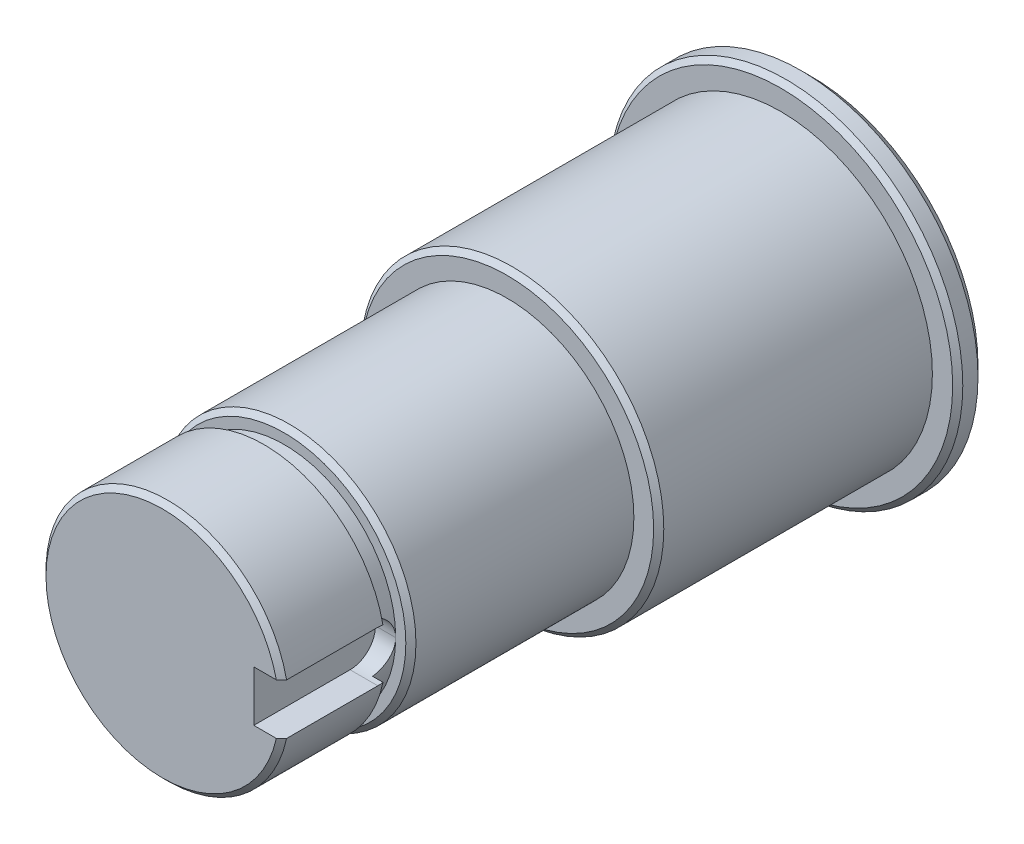
from build123d import *

# Parameters (mm, degrees)
SKETCH_1_R          = 17.45
EXTRUDE_1_DEPTH     = 3
SKETCH_2_R          = 14.95
EXTRUDE_2_DEPTH     = 27
SKETCH_4_R          = 12.5
EXTRUDE_3_DEPTH     = 22
SKETCH_5_R          = 12
EXTRUDE_4_DEPTH     = 12
CHAMFER_1_SIZE      = 0.5
SKETCH_6_W          = 1
SKETCH_6_H          = 2
CHAMFER_2_SIZE      = 0.5
CHAMFER_3_SIZE      = 1
SKETCH_7_W          = 12
SKETCH_7_H          = 5
CUT_EXTRUDE_1_DEPTH = 3
FILLET_1_R          = 2.5


with BuildPart() as part:
    # 草图1 → 拉伸1 (new body)
    with BuildSketch(Plane.XY):
        Circle(SKETCH_1_R)
    extrude(amount=EXTRUDE_1_DEPTH)

    # 草图2 → 拉伸2 (add)
    with BuildSketch(Plane.XY.offset(3)):
        Circle(SKETCH_2_R)
    extrude(amount=EXTRUDE_2_DEPTH)

    # 草图4 → 拉伸3 (add)
    with BuildSketch(Plane.XY.offset(30)):
        Circle(SKETCH_4_R)
    extrude(amount=EXTRUDE_3_DEPTH)

    # 草图5 → 拉伸4 (add)
    with BuildSketch(Plane.XY.offset(52)):
        Circle(SKETCH_5_R)
    extrude(amount=EXTRUDE_4_DEPTH)

    # 倒角1
    chamfer_1_edges = [part.edges().sort_by_distance(p)[0] for p in [
        (-12, 0, 64),
    ]]
    chamfer(chamfer_1_edges, length=CHAMFER_1_SIZE)

    # 草图6 → 切除-旋转1 (revolve, cut)
    with BuildSketch(Plane(origin=(0, 0, 0), x_dir=(1, 0, 0), z_dir=(0, 1, 0)), mode=Mode.PRIVATE) as cut_revolve_1_sk:
        with Locations((-11.5, -53)):
            Rectangle(SKETCH_6_W, SKETCH_6_H)
    revolve(cut_revolve_1_sk.sketch.rotate(Axis((0, 0, 52), (0, 0, -1)), 180), axis=Axis((0, 0, 52), (0, 0, -1)), mode=Mode.SUBTRACT)

    # 倒角2
    chamfer_2_edges = [part.edges().sort_by_distance(p)[0] for p in [
        (-12.5, 0, 52),
        (-17.45, 0, 3),
        (-14.95, 0, 30),
    ]]
    chamfer(chamfer_2_edges, length=CHAMFER_2_SIZE)

    # 倒角3
    chamfer_3_edges = [part.edges().sort_by_distance(p)[0] for p in [
        (-17.45, 0, 0),
    ]]
    chamfer(chamfer_3_edges, length=CHAMFER_3_SIZE)

    # 草图7 → 切除-拉伸1 (cut)
    with BuildSketch(Plane(origin=(12, 0, 0), x_dir=(0, 0, -1), z_dir=(1, 0, 0))):
        with Locations((-58, 0)):
            Rectangle(SKETCH_7_W, SKETCH_7_H)
    extrude(amount=-CUT_EXTRUDE_1_DEPTH, mode=Mode.SUBTRACT)

    # 圆角1
    # the kernel refuses this fillet: 2.5 mm, written as the material it adds along each edge
    with BuildSketch(Plane(origin=(16.962142643, -2.5, 52), x_dir=(0, 1, 0), z_dir=(-1, 0, 0))) as fillet_1_piece_1_section:
        with BuildLine():
            CenterArc((FILLET_1_R, -FILLET_1_R), FILLET_1_R, 90, 90)
            Line((0, -FILLET_1_R), (0, 0))
            Line((0, 0), (FILLET_1_R, 0))
        make_face()
    fillet_1_piece_1 = extrude(amount=14.212142643, mode=Mode.PRIVATE)
    fillet_1_piece_1 = fillet_1_piece_1 & Plane(origin=(0, 0, 54.124758418), x_dir=(1, 0, 0), z_dir=(0, 0, -1)) * Cylinder(12, 39, mode=Mode.PRIVATE)
    fillet_1_piece_1 = split(fillet_1_piece_1, bisect_by=Plane(origin=(11.227777132, -2.484876178, 54), z_dir=(0, 0, 1)), keep=Keep.TOP, mode=Mode.PRIVATE)
    add(fillet_1_piece_1)
    with BuildSketch(Plane(origin=(16.962142643, -2.5, 52), x_dir=(0, 1, 0), z_dir=(-1, 0, 0))) as fillet_1_piece_2_section:
        with BuildLine():
            CenterArc((FILLET_1_R, -FILLET_1_R), FILLET_1_R, 90, 90)
            Line((0, -FILLET_1_R), (0, 0))
            Line((0, 0), (FILLET_1_R, 0))
        make_face()
    fillet_1_piece_2 = extrude(amount=14.212142643, mode=Mode.PRIVATE)
    fillet_1_piece_2 = fillet_1_piece_2 & Plane(origin=(0, 0, 53.528388409), x_dir=(1, 0, 0), z_dir=(0, 0, 1)) * Cylinder(11, 39, mode=Mode.PRIVATE)
    add(fillet_1_piece_2)
    with BuildSketch(Plane(origin=(16.962142643, 2.5, 52), x_dir=(0, -1, 0), z_dir=(-1, 0, 0))) as fillet_1_piece_3_section:
        with BuildLine():
            CenterArc((FILLET_1_R, FILLET_1_R), FILLET_1_R, 180, 90)
            Line((0, FILLET_1_R), (0, 0))
            Line((0, 0), (FILLET_1_R, 0))
        make_face()
    fillet_1_piece_3 = extrude(amount=14.212142643, mode=Mode.PRIVATE)
    fillet_1_piece_3 = fillet_1_piece_3 & Plane(origin=(0, 0, 54.124758418), x_dir=(1, 0, 0), z_dir=(0, 0, -1)) * Cylinder(12, 39, mode=Mode.PRIVATE)
    fillet_1_piece_3 = split(fillet_1_piece_3, bisect_by=Plane(origin=(11.227777136, 2.484876178, 54), z_dir=(0, 0, 1)), keep=Keep.TOP, mode=Mode.PRIVATE)
    add(fillet_1_piece_3)
    with BuildSketch(Plane(origin=(16.962142643, 2.5, 52), x_dir=(0, -1, 0), z_dir=(-1, 0, 0))) as fillet_1_piece_4_section:
        with BuildLine():
            CenterArc((FILLET_1_R, FILLET_1_R), FILLET_1_R, 180, 90)
            Line((0, FILLET_1_R), (0, 0))
            Line((0, 0), (FILLET_1_R, 0))
        make_face()
    fillet_1_piece_4 = extrude(amount=14.212142643, mode=Mode.PRIVATE)
    fillet_1_piece_4 = fillet_1_piece_4 & Plane(origin=(0, 0, 53.5283884), x_dir=(1, 0, 0), z_dir=(0, 0, 1)) * Cylinder(11, 39, mode=Mode.PRIVATE)
    add(fillet_1_piece_4)


solid = part.part
